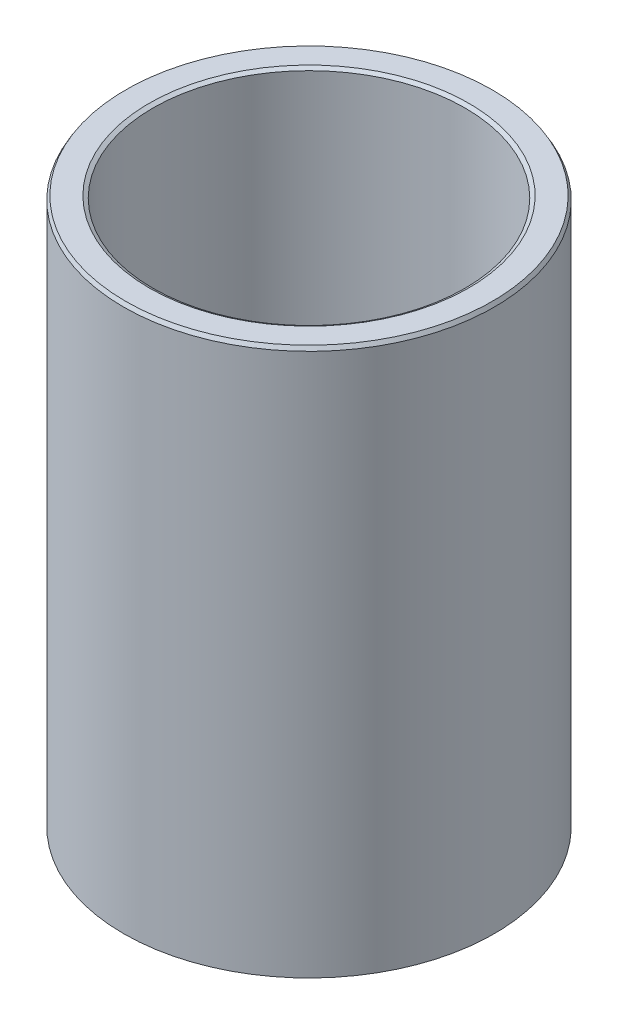
from build123d import *
from OCP.BRepFilletAPI import BRepFilletAPI_MakeChamfer

# Parameters (mm, degrees)
SKETCH1_R           = 37.5
BOSS_EXTRUDE1_DEPTH = 110.953792737
SKETCH2_R           = 31.570152752
CUT_EXTRUDE1_DEPTH  = 123.976599899
CHAMFER1_SIZE       = 0.765871511
CHAMFER1_SIZE2      = 0.442176123


with BuildPart() as part:
    # Sketch1 → Boss-Extrude1 (new body)
    with BuildSketch(Plane(origin=(0, 0, 0), x_dir=(1, 0, 0), z_dir=(0, 1, 0))):
        Circle(SKETCH1_R)
    extrude(amount=BOSS_EXTRUDE1_DEPTH)

    # Sketch2 → Cut-Extrude1 (cut, through all)
    with BuildSketch(Plane(origin=(0, 0, 0), x_dir=(1, 0, 0), z_dir=(0, 1, 0))):
        Circle(SKETCH2_R)
    extrude(amount=CUT_EXTRUDE1_DEPTH, mode=Mode.SUBTRACT)

    # Chamfer1: one chamfer whose edges measure the first distance from different faces: ONE call of the kernel's chamfer builder (chamfer() names one face for all edges)
    chamfer1_edges_1 = [part.edges().sort_by_distance(p)[0] for p in [
        (-31.570152752, 110.953792737, 0),
    ]]
    chamfer1_side_1 = [part.faces().sort_by_distance(p)[0] for p in [
        (-36.439339828, 110.953792737, 0),
    ]]
    chamfer1_edges_2 = [part.edges().sort_by_distance(p)[0] for p in [
        (-31.570152752, 0, 0),
    ]]
    chamfer1_side_2 = [part.faces().sort_by_distance(p)[0] for p in [
        (-31.570152752, 55.476896369, 0),
    ]]
    chamfer1_edges_3 = [part.edges().sort_by_distance(p)[0] for p in [
        (-37.5, 0, 0),
    ]]
    chamfer1_side_3 = [part.faces().sort_by_distance(p)[0] for p in [
        (-36.439339828, 0, 0),
    ]]
    chamfer1_edges_4 = [part.edges().sort_by_distance(p)[0] for p in [
        (-37.5, 110.953792737, 0),
    ]]
    chamfer1_side_4 = [part.faces().sort_by_distance(p)[0] for p in [
        (-37.5, 55.476896369, 0),
    ]]
    chamfer1 = BRepFilletAPI_MakeChamfer(part.part.solid().wrapped)
    for e in chamfer1_edges_1:
        chamfer1.Add(CHAMFER1_SIZE, CHAMFER1_SIZE2, e.wrapped, chamfer1_side_1[0].wrapped)  # the first distance lies on this face
    for e in chamfer1_edges_2:
        chamfer1.Add(CHAMFER1_SIZE, CHAMFER1_SIZE2, e.wrapped, chamfer1_side_2[0].wrapped)  # the first distance lies on this face
    for e in chamfer1_edges_3:
        chamfer1.Add(CHAMFER1_SIZE, CHAMFER1_SIZE2, e.wrapped, chamfer1_side_3[0].wrapped)  # the first distance lies on this face
    for e in chamfer1_edges_4:
        chamfer1.Add(CHAMFER1_SIZE, CHAMFER1_SIZE2, e.wrapped, chamfer1_side_4[0].wrapped)  # the first distance lies on this face
    add(Compound.cast(chamfer1.Shape()), mode=Mode.REPLACE)


solid = part.part
